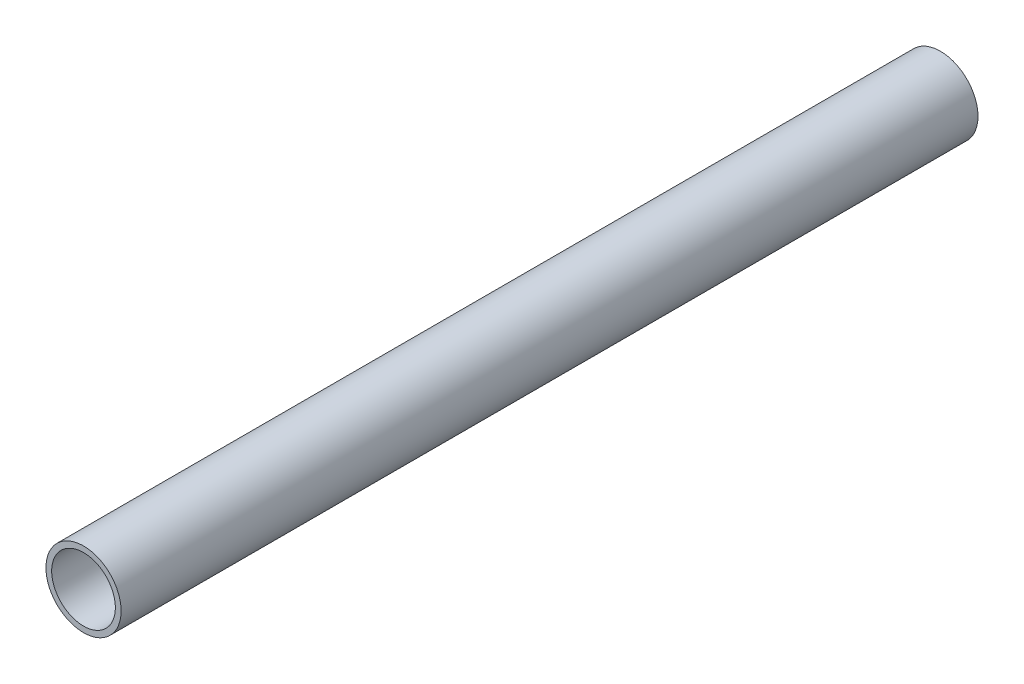
from build123d import *

# Parameters (mm, degrees)
CROQUIS1_R              = 24.13
CROQUIS1_R_2            = 20.447
SALIENTE_EXTRUIR1_DEPTH = 550


with BuildPart() as part:
    # Croquis1 → Saliente-Extruir1 (new body)
    with BuildSketch(Plane.XY):
        Circle(CROQUIS1_R)
        Circle(CROQUIS1_R_2, mode=Mode.SUBTRACT)
    extrude(amount=-SALIENTE_EXTRUIR1_DEPTH)


solid = part.part
